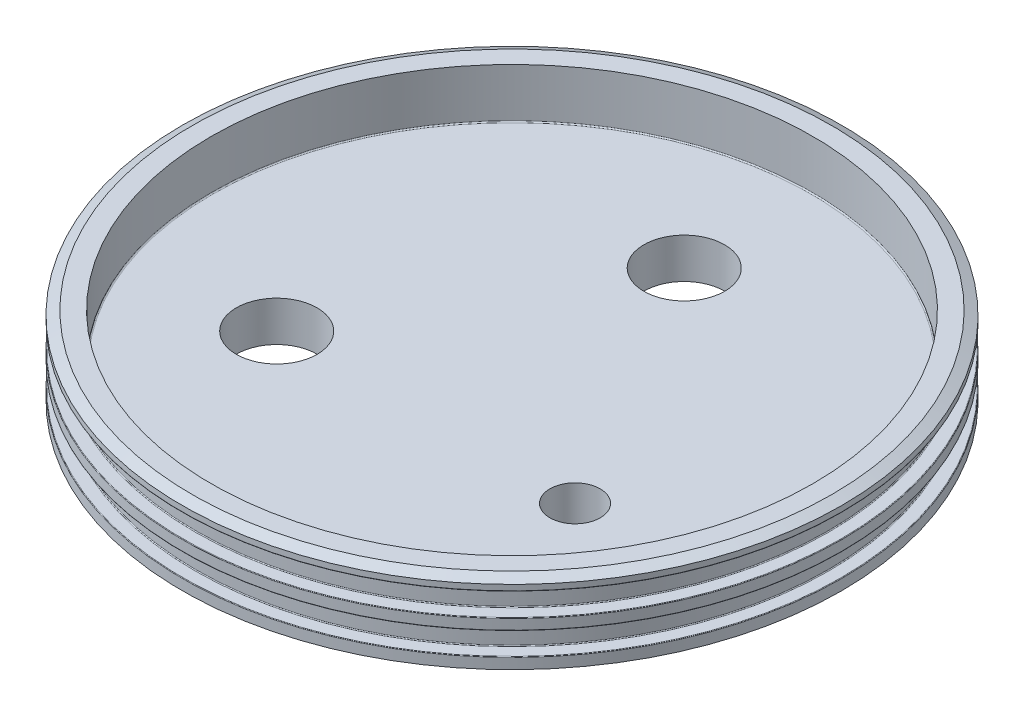
from build123d import *

# Parameters (mm, degrees)
SKETCH6_R                                = 66.04
BOSS_EXTRUDE1_DEPTH                      = 2.54
CNC_ID_FILLET_R                          = 0.1778
CNC_OD_FILLET_R                          = 0.127
CNC_CHAMFERS_SIZE                        = 1.016
CNC_CHAMFERS_SIZE2                       = 2.178819031
CNC_BORE_FILLET_R                        = 0.254
PIPE_TAP_DRILL_FOR_1_2_TAP_FILL_VALVE_D  = 17.8562
PIPE_TAP_DRILL_FOR_1_4_TAP_SOLENOID_VA_D = 11.1252
PIPE_TAP_DRILL_FOR_1_2_TAP_CRYO_VALVE_D  = 17.8562


with BuildPart() as part:
    # Sketch1 → Revolve1 (revolve)
    with BuildSketch(Plane.XY):
        Polygon((0, 0), (72.898, 0), (72.898, 2.4638), (69.977, 2.4638), (69.977, 7.4422), (72.898, 7.4422), (72.898, 9.906), (69.977, 9.906), (69.977, 14.986), (72.898, 14.986), (72.898, 17.3482), (66.548, 17.3482), (66.548, 6.35), (0, 6.35), align=None)
    revolve(axis=Axis((0, 48.192213231, 0), (0, -1, 0)))

    # Sketch6 → Boss-Extrude1 (add)
    with BuildSketch(Plane.XZ):
        Circle(SKETCH6_R)
    extrude(amount=BOSS_EXTRUDE1_DEPTH)

    # CNC ID Fillet
    cnc_id_fillet_edges = [part.edges().sort_by_distance(p)[0] for p in [
        (-69.977, 7.4422, 0),
        (-69.977, 2.4638, 0),
        (-66.04, 0, 0),
        (-69.977, 14.986, 0),
        (-69.977, 9.906, 0),
    ]]
    fillet(cnc_id_fillet_edges, radius=CNC_ID_FILLET_R)

    # CNC OD Fillet
    cnc_od_fillet_edges = [part.edges().sort_by_distance(p)[0] for p in [
        (-72.898, 7.4422, 0),
        (-72.898, 2.4638, 0),
        (-72.898, 9.906, 0),
        (-72.898, 14.986, 0),
        (-66.04, -2.54, 0),
    ]]
    fillet(cnc_od_fillet_edges, radius=CNC_OD_FILLET_R)

    # CNC Chamfers
    cnc_chamfers_edges = [part.edges().sort_by_distance(p)[0] for p in [
        (-72.898, 17.3482, 0),
    ]]
    cnc_chamfers_side = [part.faces().sort_by_distance(p)[0] for p in [
        (-72.898, 16.2306, 0),
    ]]
    chamfer(cnc_chamfers_edges, length=CNC_CHAMFERS_SIZE, length2=CNC_CHAMFERS_SIZE2, reference=cnc_chamfers_side[0])

    # CNC Bore Fillet
    cnc_bore_fillet_edges = [part.edges().sort_by_distance(p)[0] for p in [
        (-66.548, 6.35, 0),
    ]]
    fillet(cnc_bore_fillet_edges, radius=CNC_BORE_FILLET_R)

    # Pipe Tap Drill for 1/2 Tap - Fill Valve (through all)
    with Locations(Plane(origin=(0, -2.54, 0), x_dir=(-1, 0, 0), z_dir=(0, -1, 0))):
        with Locations((0, 38.1)):
            Hole(PIPE_TAP_DRILL_FOR_1_2_TAP_FILL_VALVE_D / 2)

    # Pipe Tap Drill for 1/4 Tap - Solenoid Valve (through all)
    with Locations(Plane(origin=(0, -2.54, 0), x_dir=(-1, 0, 0), z_dir=(0, -1, 0))):
        with Locations((-32.995567884, -19.05)):
            Hole(PIPE_TAP_DRILL_FOR_1_4_TAP_SOLENOID_VA_D / 2)

    # Pipe Tap Drill for 1/2 Tap - Cryo Valve (through all)
    with Locations(Plane(origin=(0, -2.54, 0), x_dir=(-1, 0, 0), z_dir=(0, -1, 0))):
        with Locations((32.995567884, -19.05)):
            Hole(PIPE_TAP_DRILL_FOR_1_2_TAP_CRYO_VALVE_D / 2)


solid = part.part
